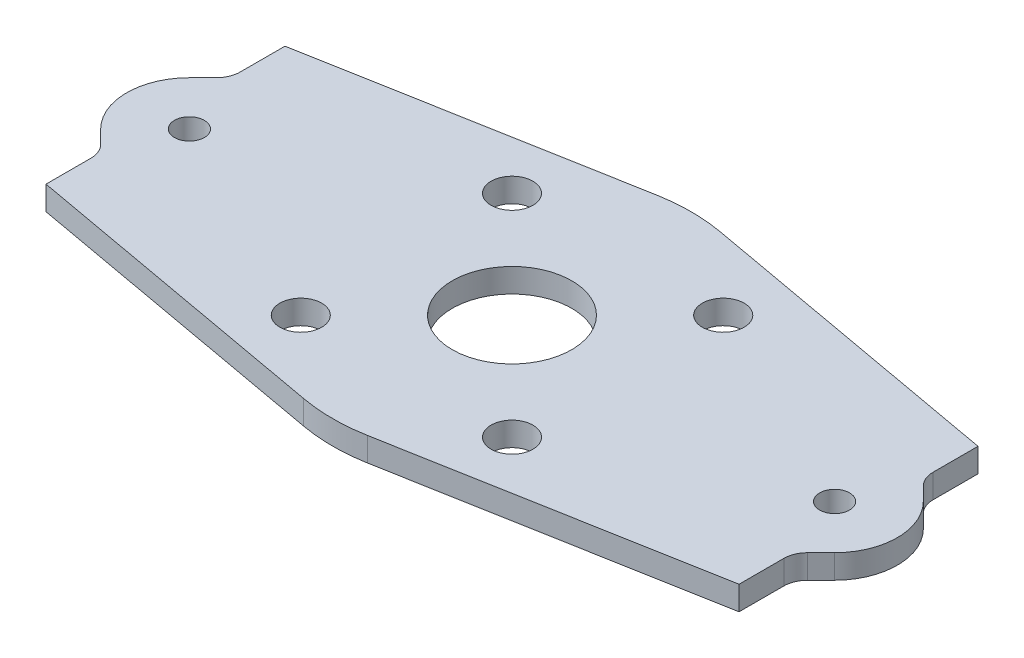
from build123d import *

# Parameters (mm, degrees)
SKETCH1_R           = 1.75
SKETCH1_R_2         = 5
SKETCH1_R_3         = 1.25
BOSS_EXTRUDE1_DEPTH = 2


with BuildPart() as part:
    # Sketch1 → Boss-Extrude1 (new body)
    with BuildSketch(Plane(origin=(0, 0, 0), x_dir=(1, 0, 0), z_dir=(0, 1, 0))):
        with BuildLine():
            ThreePointArc((2.668728536, 14.760687247), (0, 15), (-2.668728536, 14.760687247))
            Line((-2.668728536, 14.760687247), (-29, 10))
            Line((-29, 10), (-29, 6.253048327))
            ThreePointArc((-29, 6.253048327), (-29.152240935, 5.487681462), (-29.585786438, 4.838834765))
            Line((-29.585786438, 4.838834765), (-30.712310601, 3.712310601))
            ThreePointArc((-30.712310601, 3.712310601), (-32.25, 0), (-30.712310601, -3.712310601))
            Line((-30.712310601, -3.712310601), (-29.585786438, -4.838834765))
            ThreePointArc((-29.585786438, -4.838834765), (-29.152240935, -5.487681462), (-29, -6.253048327))
            Line((-29, -6.253048327), (-29, -10))
            Line((-29, -10), (-2.668728536, -14.760687247))
            ThreePointArc((-2.668728536, -14.760687247), (0, -15), (2.668728536, -14.760687247))
            Line((2.668728536, -14.760687247), (29, -10))
            Line((29, -10), (29, -6.253048327))
            ThreePointArc((29, -6.253048327), (29.152240935, -5.487681462), (29.585786438, -4.838834765))
            Line((29.585786438, -4.838834765), (30.712310601, -3.712310601))
            ThreePointArc((30.712310601, -3.712310601), (32.25, 0), (30.712310601, 3.712310601))
            Line((30.712310601, 3.712310601), (29.585786438, 4.838834765))
            ThreePointArc((29.585786438, 4.838834765), (29.152240935, 5.487681462), (29, 6.253048327))
            Line((29, 6.253048327), (29, 10))
            Line((29, 10), (2.668728536, 14.760687247))
        make_face()
        with Locations((-8.838834765, -8.838834765)):
            Circle(SKETCH1_R, mode=Mode.SUBTRACT)
        with Locations((8.838834765, -8.838834765)):
            Circle(SKETCH1_R, mode=Mode.SUBTRACT)
        Circle(SKETCH1_R_2, mode=Mode.SUBTRACT)
        with Locations((-8.838834765, 8.838834765)):
            Circle(SKETCH1_R, mode=Mode.SUBTRACT)
        with Locations((8.838834765, 8.838834765)):
            Circle(SKETCH1_R, mode=Mode.SUBTRACT)
        with Locations((27, 0)):
            Circle(SKETCH1_R_3, mode=Mode.SUBTRACT)
        with Locations((-27, 0)):
            Circle(SKETCH1_R_3, mode=Mode.SUBTRACT)
    extrude(amount=BOSS_EXTRUDE1_DEPTH)


solid = part.part
